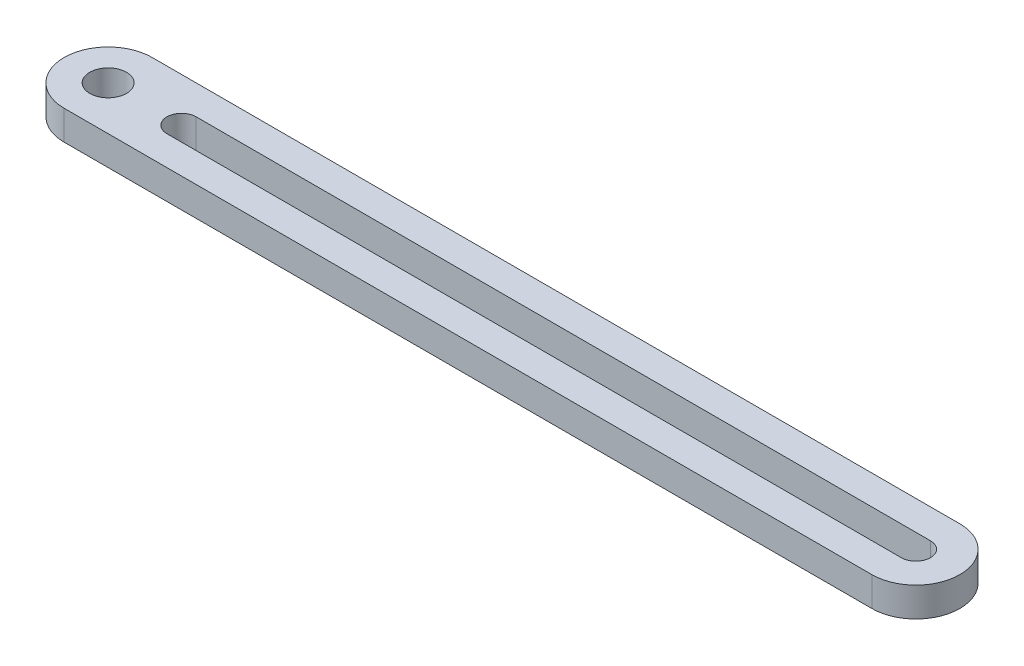
from build123d import *

# Parameters (mm, degrees)
SKETCH1_R           = 2.5
BOSS_EXTRUDE1_DEPTH = 4


with BuildPart() as part:
    # Sketch1 → Boss-Extrude1 (new body)
    with BuildSketch(Plane(origin=(0, 0, 0), x_dir=(1, 0, 0), z_dir=(0, 1, 0))):
        with BuildLine():
            Line((0, 5.991911275), (110, 5.991911275))
            ThreePointArc((110, 5.991911275), (115.991911275, 0), (110, -5.991911275))
            Line((110, -5.991911275), (0, -5.991911275))
            ThreePointArc((0, -5.991911275), (-5.991911275, 0), (0, 5.991911275))
        make_face()
        Circle(SKETCH1_R, mode=Mode.SUBTRACT)
        with BuildLine():
            Line((10, 1.991911275), (110, 1.991911275))
            ThreePointArc((110, 1.991911275), (111.991911275, 0), (110, -1.991911275))
            Line((110, -1.991911275), (10, -1.991911275))
            ThreePointArc((10, -1.991911275), (8.008088725, 0), (10, 1.991911275))
        make_face(mode=Mode.SUBTRACT)
    extrude(amount=BOSS_EXTRUDE1_DEPTH)


solid = part.part
